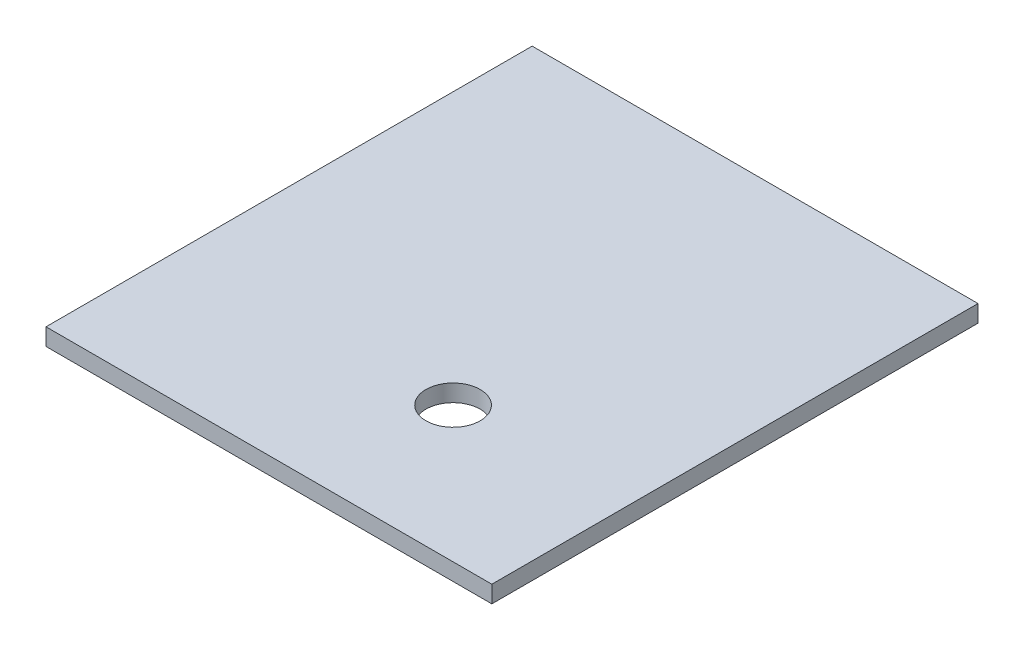
from build123d import *

# Parameters (mm, degrees)
SKETCH1_W           = 146.05
SKETCH1_H           = 159.258
BOSS_EXTRUDE1_DEPTH = 5.588
CUT_EXTRUDE1_REACH  = 110.188
SKETCH4_R           = 8.89


with BuildPart() as part:
    # Sketch1 → Boss-Extrude1 (new body)
    with BuildSketch(Plane(origin=(0, 0, 0), x_dir=(1, 0, 0), z_dir=(0, 1, 0))):
        Rectangle(SKETCH1_W, SKETCH1_H)
    extrude(amount=BOSS_EXTRUDE1_DEPTH)

    # Sketch4 → Cut-Extrude1 (cut, up to next)
    with BuildSketch(Plane(origin=(0, 5.588, 0), x_dir=(1, 0, 0), z_dir=(0, 1, 0)), mode=Mode.PRIVATE) as cut_extrude1_sk1:
        with Locations((15.875, -35.179)):
            Circle(SKETCH4_R)
    cut_extrude1_tool1 = extrude(cut_extrude1_sk1.sketch, amount=-CUT_EXTRUDE1_REACH, mode=Mode.PRIVATE) & part.part
    add(cut_extrude1_tool1.solids().sort_by_distance((15.875, 5.588, 35.179))[0], mode=Mode.SUBTRACT)


solid = part.part
